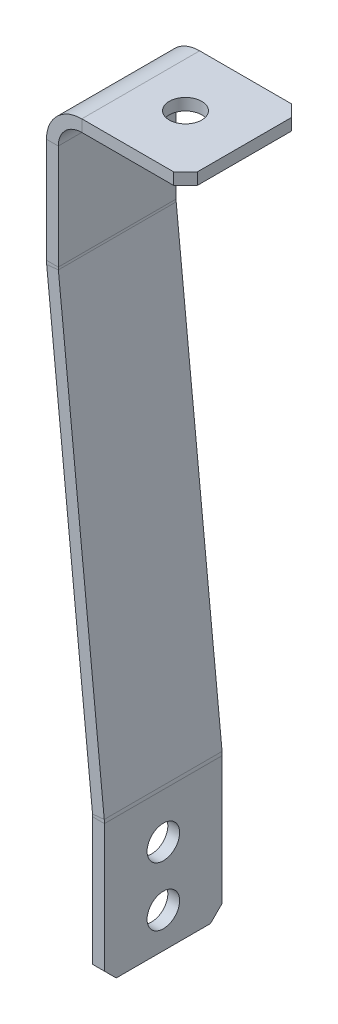
from build123d import *

# Parameters (mm, degrees)
SM_BASE_FLANGE_1_DEPTH = 50
SKETCH_6_R             = 6.9
CUT_EXTRUDE_1_DEPTH    = 10
SKETCH_7_R             = 6.9
CUT_EXTRUDE_2_DEPTH    = 10
OTHER_START            = 20.788939367
OTHER_1_OUTLINE_W      = 10
OTHER_1_OUTLINE_H      = 8
OTHER_1_DEPTH          = 3.535533906
OTHER_START_2          = 56.144278426
OTHER_1_2_OUTLINE_W    = 38
OTHER_1_2_OUTLINE_H    = 8
OTHER_1_2_DEPTH        = 3.535533906
OTHER_1_3_OUTLINE_W    = 7
OTHER_1_3_OUTLINE_H    = 10
OTHER_1_3_DEPTH        = 3.535533906
OTHER_START_3          = -35.355339059
OTHER_1_4_OUTLINE_W    = 7
OTHER_1_4_OUTLINE_H    = 38
OTHER_1_4_DEPTH        = 3.535533906


# Read off the part's stored shape, not the designer's step: Затупленный угол1
# Sheet-metal steps are written as plain solids
with BuildPart() as part:
    # Sketch 1 → Базовая кромка1 (new body)
    with BuildSketch(Plane.XY):
        with BuildLine():
            Line((34.4, 308.5), (-9.6, 308.5))
            ThreePointArc((-9.6, 308.5), (-16.671067812, 305.571067812), (-19.6, 298.5))
            Line((-19.6, 298.5), (-19.6, 254.005167492))
            ThreePointArc((-19.6, 254.005167492), (-19.58726466, 253.500643348), (-19.549091078, 252.997404261))
            Line((-19.549091078, 252.997404261), (-0.076363384, 60.753893608))
            ThreePointArc((-0.076363384, 60.753893608), (-0.01910301, 59.999034978), (0, 59.242248762))
            Line((0, 59.242248762), (0, 0))
            Line((0, 0), (-5, 0))
            Line((-5, 0), (-5, 59.242248762))
            ThreePointArc((-5, 59.242248762), (-5.01273534, 59.746772906), (-5.050908922, 60.250011993))
            Line((-5.050908922, 60.250011993), (-24.523636616, 252.493522646))
            ThreePointArc((-24.523636616, 252.493522646), (-24.58089699, 253.248381276), (-24.6, 254.005167492))
            Line((-24.6, 254.005167492), (-24.6, 298.5))
            ThreePointArc((-24.6, 298.5), (-20.206601718, 309.106601718), (-9.6, 313.5))
            Line((-9.6, 313.5), (34.4, 313.5))
            Line((34.4, 313.5), (34.4, 308.5))
        make_face()
    extrude(amount=SM_BASE_FLANGE_1_DEPTH)

    # Эскиз6 → Вырез-Вытянуть1 (cut)
    with BuildSketch(Plane.ZY.offset(5)):
        with Locations(Location((25, 15, 0), (0, 0, 270))):
            Circle(SKETCH_6_R)
        with Locations(Location((25, 40, 0), (0, 0, 270))):
            Circle(SKETCH_6_R)
    extrude(amount=-CUT_EXTRUDE_1_DEPTH, mode=Mode.SUBTRACT)

    # Эскиз7 → Вырез-Вытянуть2 (cut)
    with BuildSketch(Plane(origin=(0, 313.5, 0), x_dir=(1, 0, 0), z_dir=(0, 1, 0))):
        with Locations(Location((9.4, -25, 0), (0, 0, 180))):
            Circle(SKETCH_7_R)
    extrude(amount=-CUT_EXTRUDE_2_DEPTH, mode=Mode.SUBTRACT)

    # Other 1 outline → Other 1 (cut)
    with BuildSketch(Plane(origin=(0, 0, 0), x_dir=(0.707106781186548, 0, 0.707106781186547), z_dir=(0.707106781186547, 0, -0.707106781186548)).offset(OTHER_START)):
        with Locations((24, -311)):
            Rectangle(OTHER_1_OUTLINE_W, OTHER_1_OUTLINE_H)
    extrude(amount=OTHER_1_DEPTH, mode=Mode.SUBTRACT)

    # Other 1 2 outline → Other 1 2 (cut)
    with BuildSketch(Plane(origin=(0, 0, 0), x_dir=(0.707106781186548, 0, -0.707106781186547), z_dir=(0.707106781186547, 0, 0.707106781186548)).offset(OTHER_START_2)):
        with Locations((3, 311)):
            Rectangle(OTHER_1_2_OUTLINE_W, OTHER_1_2_OUTLINE_H)
    extrude(amount=OTHER_1_2_DEPTH, mode=Mode.SUBTRACT)

    # Other 1 3 outline → Other 1 3 (cut)
    with BuildSketch(Plane(origin=(0, 0, 0), x_dir=(1, 0, 0), z_dir=(0, 0.7071067811865476, 0.7071067811865476))):
        with Locations((-2.5, 0)):
            Rectangle(OTHER_1_3_OUTLINE_W, OTHER_1_3_OUTLINE_H)
    extrude(amount=OTHER_1_3_DEPTH, mode=Mode.SUBTRACT)

    # Other 1 4 outline → Other 1 4 (cut)
    with BuildSketch(Plane(origin=(0, 0, 0), x_dir=(1, 0, 0), z_dir=(0, 0.7071067811865476, -0.7071067811865476)).offset(OTHER_START_3)):
        with Locations((-2.5, -21)):
            Rectangle(OTHER_1_4_OUTLINE_W, OTHER_1_4_OUTLINE_H)
    extrude(amount=OTHER_1_4_DEPTH, mode=Mode.SUBTRACT)


solid = part.part
